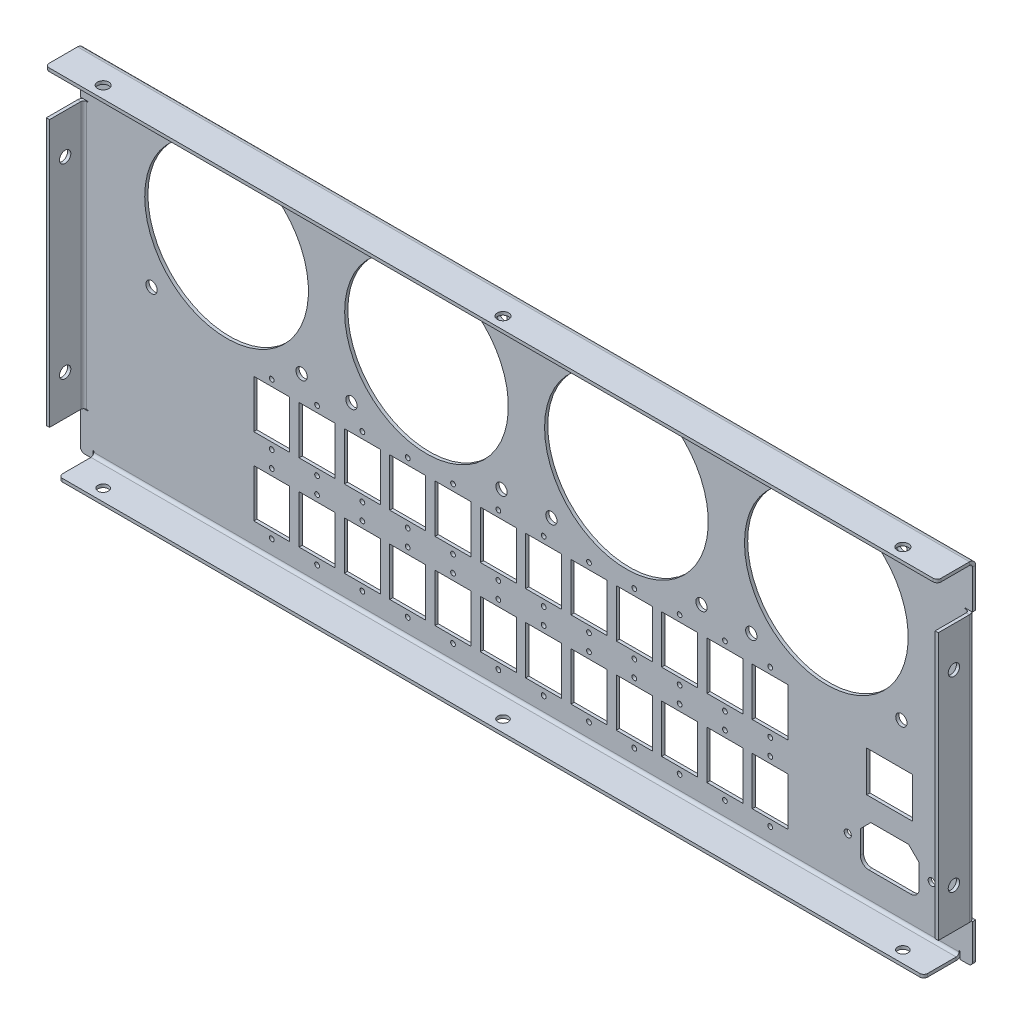
from build123d import *

# Parameters (mm, degrees)
BASE_FLANGE1_DEPTH         = 212.471
EDGE_FLANGE1_START         = -19
EDGE_FLANGE1_DEPTH         = 3.5568
EDGE_FLANGE1_START_2       = -15.4432
EDGE_FLANGE1_2_OUTLINE_W   = 412.242
EDGE_FLANGE1_2_OUTLINE_H   = 1.524
EDGE_FLANGE1_2_DEPTH       = 15.4432
EDGE_FLANGE1_START_3       = -206.121
EDGE_FLANGE1_3_DEPTH       = 412.242
EDGE_FLANGE1_4_DEPTH       = 412.242
EDGE_FLANGE2_START         = -19
EDGE_FLANGE2_DEPTH         = 0.78402424
EDGE_FLANGE2_START_2       = -18.3642
EDGE_FLANGE2_2_DEPTH       = 2.921
EDGE_FLANGE2_START_3       = -15.4432
EDGE_FLANGE2_3_OUTLINE_W   = 1.524
EDGE_FLANGE2_3_OUTLINE_H   = 127
EDGE_FLANGE2_3_DEPTH       = 14.859
EDGE_FLANGE2_START_4       = 18.9103
EDGE_FLANGE2_4_DEPTH       = 127
EDGE_FLANGE2_5_DEPTH       = 127
FILLET1_R                  = 1.905
MIRROR7_START              = -19
MIRROR7_DEPTH              = 0.78402424
MIRROR7_START_2            = -18.3642
MIRROR7_2_DEPTH            = 2.921
MIRROR7_START_3            = -15.4432
MIRROR7_3_OUTLINE_W        = 1.524
MIRROR7_3_OUTLINE_H        = 127
MIRROR7_3_DEPTH            = 14.859
MIRROR7_START_4            = 18.9103
MIRROR7_4_DEPTH            = 127
MIRROR7_5_DEPTH            = 127
SKETCH6_R                  = 2.4765
CUT_EXTRUDE2_DEPTH         = 272.327134753
SKETCH7_R                  = 2.7051
CUT_EXTRUDE3_DEPTH         = 1.524
SKETCH8_R                  = 2.6924
SKETCH8_R_2                = 39.0017
CUT_EXTRUDE7_DEPTH         = 1.524
SKETCH9_W                  = 17.145
SKETCH9_H                  = 22.86
CUT_EXTRUDE8_DEPTH         = 1.524
TAP_DRILL_FOR_4_40_TAP1_D  = 2.2606
LPATTERN1_COUNT            = 2
LPATTERN1_PITCH            = 36.83
LPATTERN1_COUNT_DIR2       = 12
LPATTERN1_PITCH_DIR2       = 21.59
SKETCH15_W                 = 21.9
SKETCH15_H                 = 19.3
CUT_EXTRUDE9_DEPTH         = 272.327134753
F_3_4_3_4_DIAMETER_HOLE2_D = 3.4
SKETCH18_R                 = 2.7051
CUT_EXTRUDE10_DEPTH        = 458.220069087


with BuildPart() as part:
    # Base-Flange1: sheet metal written as solids
    # Sketch1 → Base-Flange1 (new, symmetric)
    with BuildSketch(Plane(origin=(0, 0, 0), x_dir=(0, 0, -1), z_dir=(1, 0, 0))):
        with BuildLine():
            Line((18.3642, 0), (18.3642, 164.8206))
            ThreePointArc((18.3642, 164.8206), (17.508658908, 166.886058908), (15.4432, 167.7416))
            Line((15.4432, 167.7416), (0, 167.7416))
            Line((0, 167.7416), (0, 166.2176))
            Line((0, 166.2176), (15.4432, 166.2176))
            ThreePointArc((15.4432, 166.2176), (16.431028173, 165.808428173), (16.8402, 164.8206))
            Line((16.8402, 164.8206), (16.8402, 0))
            Line((16.8402, 0), (18.3642, 0))
        make_face()
    extrude(amount=BASE_FLANGE1_DEPTH, both=True)

    # Edge-Flange1: read off the stored shape, not the designer's step
    # Edge-Flange1 outline → Edge-Flange1 (cut)
    with BuildSketch(Plane.XY.offset(EDGE_FLANGE1_START)):
        with BuildLine():
            Line((-206.502, 0), (-206.121, 0))
            Line((-206.121, 0), (-206.121, 3.302))
            ThreePointArc((-206.121, 3.302), (-206.3115, 3.4925), (-206.502, 3.302))
            Line((-206.502, 3.302), (-206.502, 0))
        make_face()
        with BuildLine():
            Line((206.121, 3.302), (206.121, 0))
            Line((206.121, 0), (206.502, 0))
            Line((206.502, 0), (206.502, 3.302))
            ThreePointArc((206.502, 3.302), (206.3115, 3.4925), (206.121, 3.302))
        make_face()
    extrude(amount=EDGE_FLANGE1_DEPTH, mode=Mode.SUBTRACT)

    # Edge-Flange1 3 outline → Edge-Flange1 3 (cut)
    with BuildSketch(Plane.YZ.offset(EDGE_FLANGE1_START_3)):
        with BuildLine():
            ThreePointArc((2.921, -18.3642), (1.429087804, -17.954462432), (0.355725745, -16.8402))
            Line((0.355725745, -16.8402), (0, -16.8402))
            Line((0, -16.8402), (0, -18.3642))
            Line((0, -18.3642), (2.921, -18.3642))
        make_face()
    extrude(amount=EDGE_FLANGE1_3_DEPTH, mode=Mode.SUBTRACT)



with BuildPart() as body_2:
    # Edge-Flange1 2 outline → Edge-Flange1 2 (new body)
    with BuildSketch(Plane.XY.offset(EDGE_FLANGE1_START_2)):
        with Locations((0, 0.762)):
            Rectangle(EDGE_FLANGE1_2_OUTLINE_W, EDGE_FLANGE1_2_OUTLINE_H)
    extrude(amount=EDGE_FLANGE1_2_DEPTH)


with BuildPart() as part_1:
    add(part.part)

    add(body_2.part)  # Edge-Flange1 4 merges body 2
    # Edge-Flange1 4 outline → Edge-Flange1 4 (add)
    with BuildSketch(Plane.YZ.offset(EDGE_FLANGE1_START_3)):
        with BuildLine():
            Line((1.524, -15.4432), (0, -15.4432))
            ThreePointArc((0, -15.4432), (0.090328075, -16.163989464), (0.355725745, -16.8402))
            Line((0.355725745, -16.8402), (2.921, -16.8402))
            ThreePointArc((2.921, -16.8402), (1.933171827, -16.431028173), (1.524, -15.4432))
        make_face()
    extrude(amount=EDGE_FLANGE1_4_DEPTH)

    # Edge-Flange2: read off the stored shape, not the designer's step
    # Edge-Flange2 outline → Edge-Flange2 (cut)
    with BuildSketch(Plane.XY.offset(EDGE_FLANGE2_START)):
        with BuildLine():
            Line((-212.471, 18.5293), (-209.169, 18.5293))
            ThreePointArc((-209.169, 18.5293), (-208.9785, 18.7198), (-209.169, 18.9103))
            Line((-209.169, 18.9103), (-210.947, 18.9103))
            Line((-210.947, 18.9103), (-210.947, 145.9103))
            Line((-210.947, 145.9103), (-209.169, 145.9103))
            ThreePointArc((-209.169, 145.9103), (-208.9785, 146.1008), (-209.169, 146.2913))
            Line((-209.169, 146.2913), (-212.471, 146.2913))
            Line((-212.471, 146.2913), (-212.471, 18.5293))
        make_face()
    extrude(amount=EDGE_FLANGE2_DEPTH, mode=Mode.SUBTRACT)

    # Edge-Flange2 2 outline → Edge-Flange2 2 (cut)
    with BuildSketch(Plane.XY.offset(EDGE_FLANGE2_START_2)):
        with BuildLine():
            Line((-209.169, 18.9103), (-212.471, 18.9103))
            Line((-212.471, 18.9103), (-212.471, 18.5293))
            Line((-212.471, 18.5293), (-209.169, 18.5293))
            ThreePointArc((-209.169, 18.5293), (-208.9785, 18.7198), (-209.169, 18.9103))
        make_face()
        with BuildLine():
            Line((-212.471, 146.2913), (-212.471, 145.9103))
            Line((-212.471, 145.9103), (-209.169, 145.9103))
            ThreePointArc((-209.169, 145.9103), (-208.9785, 146.1008), (-209.169, 146.2913))
            Line((-209.169, 146.2913), (-212.471, 146.2913))
        make_face()
    extrude(amount=EDGE_FLANGE2_2_DEPTH, mode=Mode.SUBTRACT)

    # Edge-Flange2 4 outline → Edge-Flange2 4 (cut)
    with BuildSketch(Plane(origin=(0, 0, 0), x_dir=(1, 0, 0), z_dir=(0, 1, 0)).offset(EDGE_FLANGE2_START_4)):
        with BuildLine():
            Line((-212.471, 16.8402), (-212.115274255, 16.8402))
            ThreePointArc((-212.115274255, 16.8402), (-211.041912196, 17.954462432), (-209.55, 18.3642))
            Line((-209.55, 18.3642), (-210.947, 18.3642))
            Line((-210.947, 18.3642), (-210.947, 18.21597576))
            Line((-210.947, 18.21597576), (-212.471, 18.21597576))
            Line((-212.471, 18.21597576), (-212.471, 16.8402))
        make_face()
    extrude(amount=EDGE_FLANGE2_4_DEPTH, mode=Mode.SUBTRACT)



with BuildPart() as body_2_2:
    # Edge-Flange2 3 outline → Edge-Flange2 3 (new body)
    with BuildSketch(Plane.XY.offset(EDGE_FLANGE2_START_3)):
        with Locations((-211.709, 82.4103)):
            Rectangle(EDGE_FLANGE2_3_OUTLINE_W, EDGE_FLANGE2_3_OUTLINE_H)
    extrude(amount=EDGE_FLANGE2_3_DEPTH)


with BuildPart() as part_2:
    add(part_1.part)

    add(body_2_2.part)  # Edge-Flange2 5 merges body 2 2
    # Edge-Flange2 5 outline → Edge-Flange2 5 (add)
    with BuildSketch(Plane(origin=(0, 0, 0), x_dir=(1, 0, 0), z_dir=(0, 1, 0)).offset(EDGE_FLANGE2_START_4)):
        with BuildLine():
            ThreePointArc((-212.115274255, 16.8402), (-212.380671925, 16.163989464), (-212.471, 15.4432))
            Line((-212.471, 15.4432), (-210.947, 15.4432))
            ThreePointArc((-210.947, 15.4432), (-210.537828173, 16.431028173), (-209.55, 16.8402))
            Line((-209.55, 16.8402), (-212.115274255, 16.8402))
        make_face()
    extrude(amount=EDGE_FLANGE2_5_DEPTH)

    # Fillet1
    fillet1_edges = [part_2.edges().sort_by_distance(p)[0] for p in [
        (212.471, 0, -17.6022),
        (-206.121, 0.762, 0),
        (206.121, 0.762, 0),
        (212.471, 166.9796, 0),
        (-212.471, 0, -17.6022),
        (-212.471, 166.9796, 0),
    ]]
    fillet(fillet1_edges, radius=FILLET1_R)

    # Mirror7: read off the stored shape, not the designer's step
    # Mirror7 outline → Mirror7 (cut)
    with BuildSketch(Plane.XY.offset(MIRROR7_START)):
        with BuildLine():
            Line((212.471, 146.2913), (209.169, 146.2913))
            ThreePointArc((209.169, 146.2913), (208.9785, 146.1008), (209.169, 145.9103))
            Line((209.169, 145.9103), (210.947, 145.9103))
            Line((210.947, 145.9103), (210.947, 18.9103))
            Line((210.947, 18.9103), (209.169, 18.9103))
            ThreePointArc((209.169, 18.9103), (208.9785, 18.7198), (209.169, 18.5293))
            Line((209.169, 18.5293), (212.471, 18.5293))
            Line((212.471, 18.5293), (212.471, 146.2913))
        make_face()
    extrude(amount=MIRROR7_DEPTH, mode=Mode.SUBTRACT)

    # Mirror7 2 outline → Mirror7 2 (cut)
    with BuildSketch(Plane.XY.offset(MIRROR7_START_2)):
        with BuildLine():
            Line((209.169, 145.9103), (212.471, 145.9103))
            Line((212.471, 145.9103), (212.471, 146.2913))
            Line((212.471, 146.2913), (209.169, 146.2913))
            ThreePointArc((209.169, 146.2913), (208.9785, 146.1008), (209.169, 145.9103))
        make_face()
        with BuildLine():
            Line((212.471, 18.5293), (212.471, 18.9103))
            Line((212.471, 18.9103), (209.169, 18.9103))
            ThreePointArc((209.169, 18.9103), (208.9785, 18.7198), (209.169, 18.5293))
            Line((209.169, 18.5293), (212.471, 18.5293))
        make_face()
    extrude(amount=MIRROR7_2_DEPTH, mode=Mode.SUBTRACT)

    # Mirror7 4 outline → Mirror7 4 (cut)
    with BuildSketch(Plane(origin=(0, 0, 0), x_dir=(1, 0, 0), z_dir=(0, 1, 0)).offset(MIRROR7_START_4)):
        with BuildLine():
            ThreePointArc((209.55, 18.3642), (211.041912196, 17.954462432), (212.115274255, 16.8402))
            Line((212.115274255, 16.8402), (212.471, 16.8402))
            Line((212.471, 16.8402), (212.471, 18.21597576))
            Line((212.471, 18.21597576), (210.947, 18.21597576))
            Line((210.947, 18.21597576), (210.947, 18.3642))
            Line((210.947, 18.3642), (209.55, 18.3642))
        make_face()
    extrude(amount=MIRROR7_4_DEPTH, mode=Mode.SUBTRACT)



with BuildPart() as body_2_3:
    # Mirror7 3 outline → Mirror7 3 (new body)
    with BuildSketch(Plane.XY.offset(MIRROR7_START_3)):
        with Locations((211.709, 82.4103)):
            Rectangle(MIRROR7_3_OUTLINE_W, MIRROR7_3_OUTLINE_H)
    extrude(amount=MIRROR7_3_DEPTH)


with BuildPart() as part_3:
    add(part_2.part)

    add(body_2_3.part)  # Mirror7 5 merges body 2 3
    # Mirror7 5 outline → Mirror7 5 (add)
    with BuildSketch(Plane(origin=(0, 0, 0), x_dir=(1, 0, 0), z_dir=(0, 1, 0)).offset(MIRROR7_START_4)):
        with BuildLine():
            Line((210.947, 15.4432), (212.471, 15.4432))
            ThreePointArc((212.471, 15.4432), (212.380671925, 16.163989464), (212.115274255, 16.8402))
            Line((212.115274255, 16.8402), (209.55, 16.8402))
            ThreePointArc((209.55, 16.8402), (210.537828173, 16.431028173), (210.947, 15.4432))
        make_face()
    extrude(amount=MIRROR7_5_DEPTH)

    # Sketch6 → Cut-Extrude2 (cut, through all)
    with BuildSketch(Plane(origin=(0, 167.7416, 0), x_dir=(1, 0, 0), z_dir=(0, 1, 0))):
        with Locations(Location((-190.5, 5.6642, 0), (0, 0, 270))):
            Circle(SKETCH6_R)
        with Locations(Location((0, 5.6642, 0), (0, 0, 270))):
            Circle(SKETCH6_R)
        with Locations(Location((190.5, 5.6642, 0), (0, 0, 270))):
            Circle(SKETCH6_R)
    extrude(amount=-CUT_EXTRUDE2_DEPTH, mode=Mode.SUBTRACT)

    # Sketch7 → Cut-Extrude3 (cut)
    with BuildSketch(Plane(origin=(0, 167.7416, 0), x_dir=(1, 0, 0), z_dir=(0, 1, 0))):
        with Locations(Location((-190.5, 5.6642, 0), (0, 0, 270))):
            Circle(SKETCH7_R)
        with Locations(Location((0, 5.6642, 0), (0, 0, 270))):
            Circle(SKETCH7_R)
        with Locations(Location((190.5, 5.6642, 0), (0, 0, 270))):
            Circle(SKETCH7_R)
    extrude(amount=-CUT_EXTRUDE3_DEPTH, mode=Mode.SUBTRACT)

    # Sketch8 → Cut-Extrude7 (cut)
    with BuildSketch(Plane.XY.offset(-18.3642)):
        with Locations(Location((178.625, 156.3238, 0), (0, 0, 180))):
            Circle(SKETCH8_R)
        with Locations(Location((107.125, 156.3238, 0), (0, 0, 180))):
            Circle(SKETCH8_R)
        with Locations(Location((178.625, 84.8238, 0), (0, 0, 180))):
            Circle(SKETCH8_R)
        with Locations(Location((107.125, 84.8238, 0), (0, 0, 180))):
            Circle(SKETCH8_R)
        with Locations(Location((142.875, 120.5738, 0), (0, 0, 180))):
            Circle(SKETCH8_R_2)
        with Locations(Location((83.375, 156.3238, 0), (0, 0, 180))):
            Circle(SKETCH8_R)
        with Locations(Location((11.875, 156.3238, 0), (0, 0, 180))):
            Circle(SKETCH8_R)
        with Locations(Location((83.375, 84.8238, 0), (0, 0, 180))):
            Circle(SKETCH8_R)
        with Locations(Location((11.875, 84.8238, 0), (0, 0, 180))):
            Circle(SKETCH8_R)
        with Locations(Location((47.625, 120.5738, 0), (0, 0, 180))):
            Circle(SKETCH8_R_2)
        with Locations(Location((-11.875, 156.3238, 0), (0, 0, 180))):
            Circle(SKETCH8_R)
        with Locations(Location((-83.375, 156.3238, 0), (0, 0, 180))):
            Circle(SKETCH8_R)
        with Locations(Location((-11.875, 84.8238, 0), (0, 0, 180))):
            Circle(SKETCH8_R)
        with Locations(Location((-83.375, 84.8238, 0), (0, 0, 180))):
            Circle(SKETCH8_R)
        with Locations(Location((-47.625, 120.5738, 0), (0, 0, 180))):
            Circle(SKETCH8_R_2)
        with Locations(Location((-107.125, 156.3238, 0), (0, 0, 180))):
            Circle(SKETCH8_R)
        with Locations(Location((-178.625, 156.3238, 0), (0, 0, 180))):
            Circle(SKETCH8_R)
        with Locations(Location((-107.125, 84.8238, 0), (0, 0, 180))):
            Circle(SKETCH8_R)
        with Locations(Location((-178.625, 84.8238, 0), (0, 0, 180))):
            Circle(SKETCH8_R)
        with Locations(Location((-142.875, 120.5738, 0), (0, 0, 180))):
            Circle(SKETCH8_R_2)
    extrude(amount=CUT_EXTRUDE7_DEPTH, mode=Mode.SUBTRACT)

    # Sketch9 → Cut-Extrude8 (cut)
    with BuildSketch(Plane(origin=(0, 0, -18.3642), x_dir=(-1, 0, 0), z_dir=(0, 0, -1))):
        with Locations((121.3485, 24.13)):
            Rectangle(SKETCH9_W, SKETCH9_H)
    cut_extrude8 = extrude(amount=-CUT_EXTRUDE8_DEPTH, mode=Mode.SUBTRACT)

    # Tap Drill for #4-40 Tap1 (through all)
    with Locations(Plane.XY.offset(-16.8402)):
        with Locations((-121.3485, 38.6334), (-121.3485, 9.6266)):
            tap_drill_for_4_40_tap1 = Hole(TAP_DRILL_FOR_4_40_TAP1_D / 2)

    # LPattern1: Cut-Extrude8, Tap Drill for _4-40 Tap1 2 × 12
    with Locations(*[(j * LPATTERN1_PITCH_DIR2, i * LPATTERN1_PITCH, 0) for i in range(LPATTERN1_COUNT) for j in range(LPATTERN1_COUNT_DIR2) if (i, j) != (0, 0)]):
        add(cut_extrude8, mode=Mode.SUBTRACT)
        add(tap_drill_for_4_40_tap1, mode=Mode.SUBTRACT)

    # Sketch15 → Cut-Extrude9 (cut, through all)
    with BuildSketch(Plane(origin=(0, 0, -18.3642), x_dir=(-1, 0, 0), z_dir=(0, 0, -1))):
        with BuildLine():
            Line((-182.071, 35.24), (-187.071, 30.24))
            Line((-187.071, 30.24), (-187.071, 19.24))
            ThreePointArc((-187.071, 19.24), (-185.899427125, 16.411572875), (-183.071, 15.24))
            Line((-183.071, 15.24), (-163.071, 15.24))
            ThreePointArc((-163.071, 15.24), (-160.242572875, 16.411572875), (-159.071, 19.24))
            Line((-159.071, 19.24), (-159.071, 30.24))
            Line((-159.071, 30.24), (-164.071, 35.24))
            Line((-164.071, 35.24), (-182.071, 35.24))
        make_face()
        with Locations((-173.071, 55.37)):
            Rectangle(SKETCH15_W, SKETCH15_H)
    extrude(amount=-CUT_EXTRUDE9_DEPTH, mode=Mode.SUBTRACT)

    # Ø3.4 (3.4) Diameter Hole2 (through all)
    with Locations(Plane(origin=(0, 0, -18.3642), x_dir=(-1, 0, 0), z_dir=(0, 0, -1))):
        with Locations((-193.071, 25.24), (-153.071, 25.24)):
            Hole(F_3_4_3_4_DIAMETER_HOLE2_D / 2)

    # Sketch18 → Cut-Extrude10 (cut, through all)
    with BuildSketch(Plane.ZY.offset(212.471)):
        with Locations((-8.0137, 126.8603)):
            Circle(SKETCH18_R)
        with Locations((-8.0137, 37.9603)):
            Circle(SKETCH18_R)
    extrude(amount=-CUT_EXTRUDE10_DEPTH, mode=Mode.SUBTRACT)


solid = part_3.part
